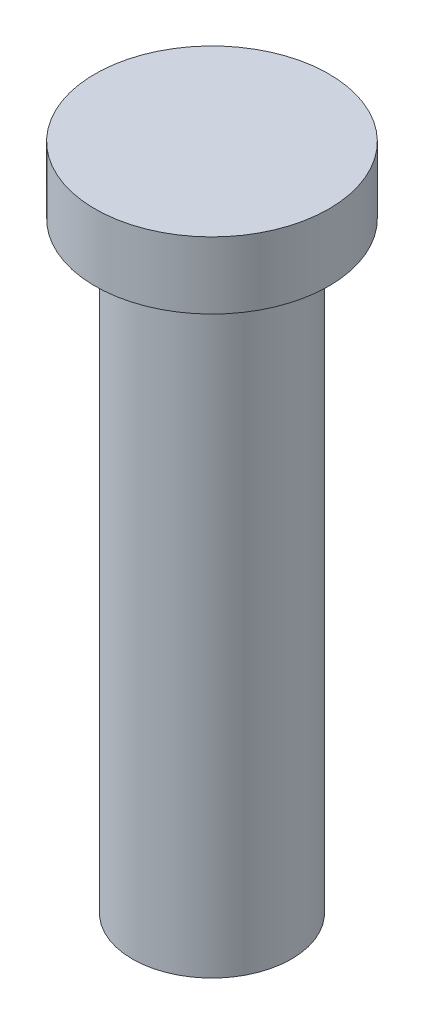
from build123d import *

# Parameters (mm, degrees)
REVOLVE1_ANGLE = 359.999695921


with BuildPart() as part:
    # Sketch1 → Revolve1 (revolve)
    with BuildSketch(Plane.XY):
        Polygon((0, 0), (4.7625, 0), (4.7625, 36), (7, 36), (7, 40), (0, 40), align=None)
    revolve(axis=Axis((0, 0, 0), (0, 1, 0)), revolution_arc=REVOLVE1_ANGLE)


solid = part.part
